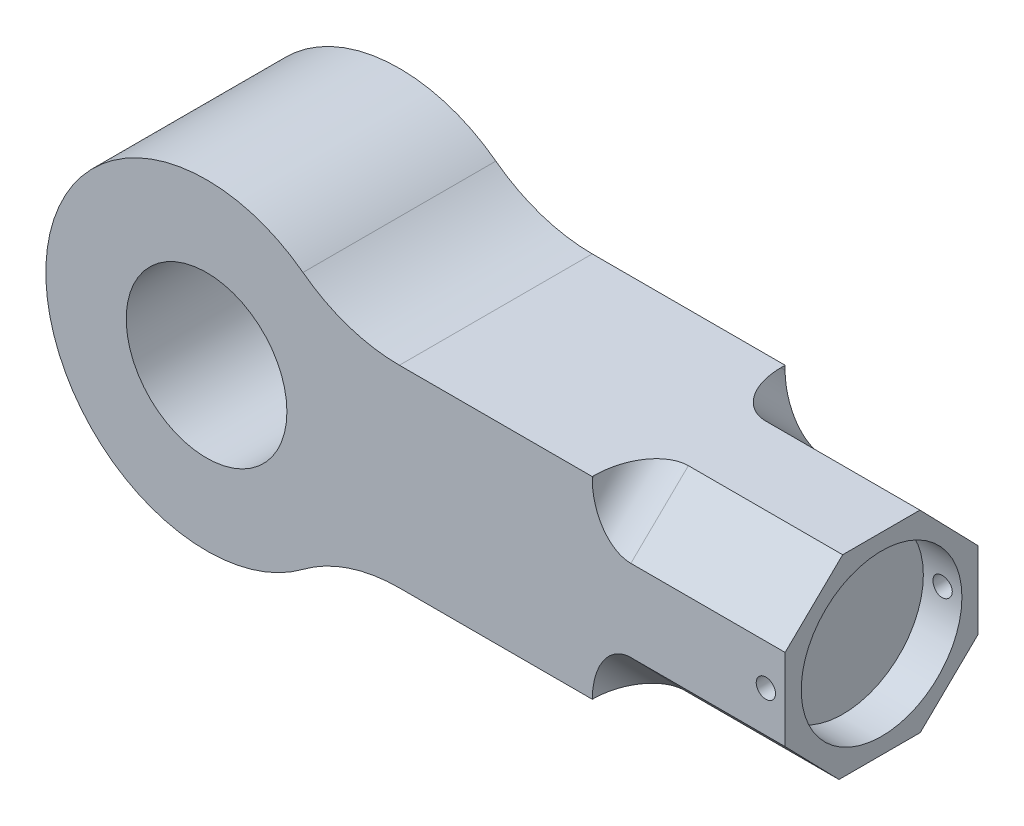
from build123d import *

# Parameters (mm, degrees)
SKETCH1_R              = 250
BOSS_EXTRUDE1_DEPTH    = 600
CUT_EXTRUDE6_DEPTH     = 600
CUT_EXTRUDE8_START     = -1
CUT_EXTRUDE8_OUTLINE_W = 600
CUT_EXTRUDE8_OUTLINE_H = 174.000412652
CUT_EXTRUDE8_DEPTH     = 1
FILLET2_R              = 120
SKETCH8_R              = 250
CUT_EXTRUDE10_DEPTH    = 120
SKETCH9_R              = 30
CUT_EXTRUDE11_DEPTH    = 1963.141687035


# Read off the part's stored shape, not the designer's step: Cut-Extrude8
with BuildPart() as part:
    # Sketch1 → Boss-Extrude1 (new body)
    with BuildSketch(Plane.XY):
        with BuildLine():
            Line((600, 300), (1800, 300))
            Line((1800, 300), (1800, -300))
            Line((1800, -300), (600, -300))
            ThreePointArc((600, -300), (441.886116992, -325.658350975), (300, -400))
            ThreePointArc((300, -400), (-500, 0), (300, 400))
            ThreePointArc((300, 400), (441.886116992, 325.658350975), (600, 300))
        make_face()
        Circle(SKETCH1_R, mode=Mode.SUBTRACT)
    extrude(amount=BOSS_EXTRUDE1_DEPTH)

    # Sketch2 → Cut-Extrude6 (cut)
    with BuildSketch(Plane(origin=(1800, 0, 0), x_dir=(0, 0, -1), z_dir=(1, 0, 0))):
        Polygon((-180.6, 300), (0, 114), (0, 300), align=None)
        Polygon((-600, -300), (-432.420494682, -300), (-600, -127.409811799), align=None)
        Polygon((-0.445053521, -300), (-0.445053521, -125.999587348), (-179.648136318, -300), align=None)
        Polygon((-606.599587348, 119.845053521), (-606.599587348, 300.445053521), (-420.599587348, 300.445053521), align=None)
    extrude(amount=-CUT_EXTRUDE6_DEPTH, mode=Mode.SUBTRACT)

    # Cut-Extrude8 outline → Cut-Extrude8 (cut)
    with BuildSketch(Plane(origin=(0, 0, 0), x_dir=(-1, 0, 0), z_dir=(0, 0, -1)).offset(CUT_EXTRUDE8_START)):
        with Locations((-1500, -212.999793674)):
            Rectangle(CUT_EXTRUDE8_OUTLINE_W, CUT_EXTRUDE8_OUTLINE_H)
    extrude(amount=CUT_EXTRUDE8_DEPTH, mode=Mode.SUBTRACT)

    # Fillet2
    fillet2_edges = [part.edges().sort_by_distance(p)[0] for p in [
        (1200, 213.126519973, 510.528974059),
        (1200, -213.269211239, 90.324068159),
        (1200, -213.7049059, 516.210247341),
        (1200, 207, 90.3),
    ]]
    fillet(fillet2_edges, radius=FILLET2_R)

    # Sketch8 → Cut-Extrude10 (cut)
    with BuildSketch(Plane(origin=(1800, 0, 0), x_dir=(0, 0, -1), z_dir=(1, 0, 0))):
        with Locations((-300, 0)):
            Circle(SKETCH8_R)
    extrude(amount=-CUT_EXTRUDE10_DEPTH, mode=Mode.SUBTRACT)

    # Sketch9 → Cut-Extrude11 (cut, through all)
    with BuildSketch(Plane(origin=(0, 0, 0), x_dir=(-1, 0, 0), z_dir=(0, 0, -1))):
        with Locations((-1740, 0)):
            Circle(SKETCH9_R)
    extrude(amount=-CUT_EXTRUDE11_DEPTH, mode=Mode.SUBTRACT)


solid = part.part
